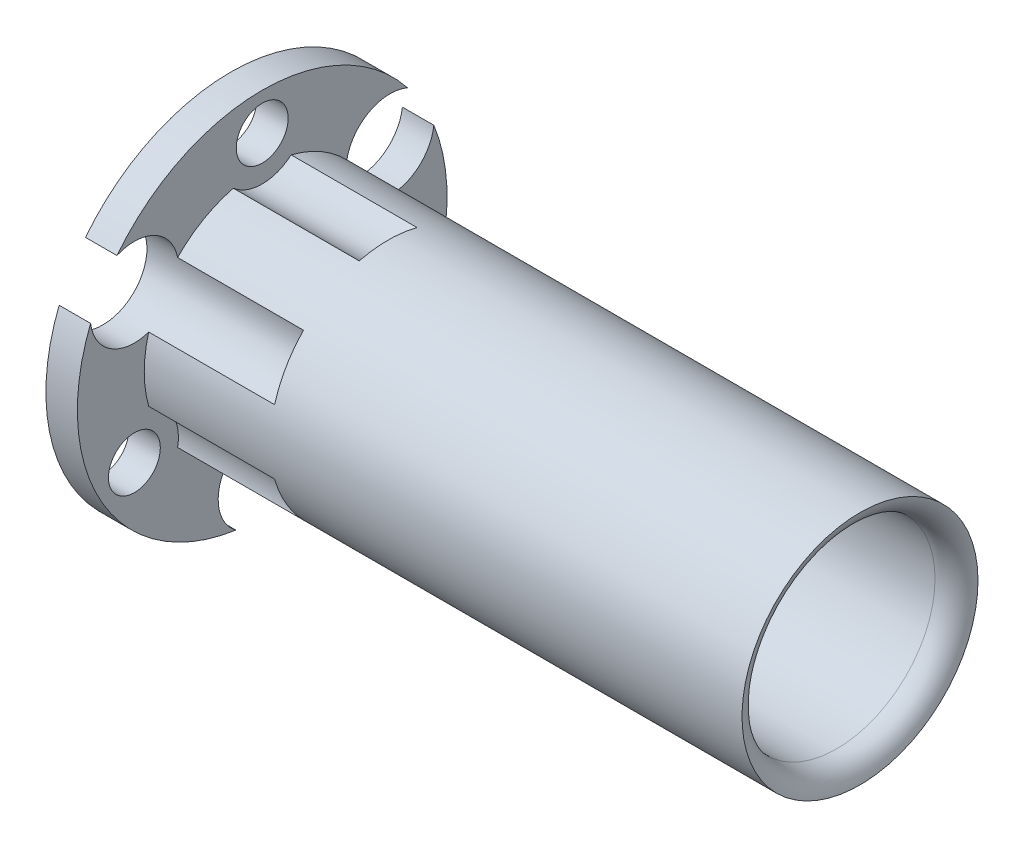
from build123d import *
from build123d.topology import SkipClean

# Parameters (mm, degrees)
SKETCH1_R                 = 1.6500000000000006
SKETCH1_R_2               = 6.25
SKETCH1_R_3               = 1.6500000000000004
BOSS_EXTRUDE1_DEPTH       = 2
BOSS_EXTRUDE2_START       = 2
BOSS_EXTRUDE2_OUTLINE_R   = 7.5
BOSS_EXTRUDE2_OUTLINE_R_2 = 6.25
BOSS_EXTRUDE2_DEPTH       = 38
CUT_EXTRUDE2_START        = 2
SKETCH1_4_R               = 2.8
SKETCH1_4_R_2             = 2.8000000000000003
SKETCH1_4_R_3             = 2.7999999999999994
SKETCH1_4_R_4             = 2.8000000000000016
CUT_EXTRUDE2_DEPTH        = 8
CUT_EXTRUDE3_START        = 2
SKETCH1_5_R               = 2.8
SKETCH1_5_R_2             = 2.7999999999999994
SKETCH1_5_R_3             = 2.8000000000000016
CUT_EXTRUDE3_DEPTH        = 46.314258622305886
FILLET1_R                 = 1.5


# Read off the part's stored shape, not the designer's step: Boss-Extrude2
with BuildPart() as part:
    # Sketch1 → Boss-Extrude1 (new body)
    with BuildSketch(Plane(origin=(0, 0, 0), x_dir=(0, 0, -1), z_dir=(1, 0, 0))):
        with BuildLine():
            ThreePointArc((-9.235679756024062, 7.263932780812693), (-6.819714318196267, 7.1682440093196265), (-5.379034853060263, 5.226469558848167))
            ThreePointArc((-5.37903485305997, 5.226469558848125), (-6.495190528383201, 3.7500000000001563), (-7.215772836598412, 2.0451460511681123))
            ThreePointArc((-7.215772836598439, 2.0451460511681465), (-9.617738571694561, 2.3219238414507375), (-10.908590197578363, 4.366366899528586))
            ThreePointArc((-10.908590197578294, 4.366366899528582), (-10.175798494467182, -5.8749999999999565), (-1.672910441554004, -11.630299680340986))
            ThreePointArc((-1.6729104415540204, -11.630299680341029), (-2.7980242534982347, -9.490167850770279), (-1.836737983538199, -7.271615610016004))
            ThreePointArc((-1.8367379835382087, -7.271615610015976), (-1.38e-15, -7.500000000000001), (1.8367379835382058, -7.271615610015976))
            ThreePointArc((1.8367379835381987, -7.271615610016002), (2.798024253498237, -9.49016785077028), (1.6729104415540168, -11.630299680341032))
            ThreePointArc((1.672910441553996, -11.630299680340986), (10.175798494467136, -5.8750000000000355), (10.908590197578357, 4.366366899528418))
            ThreePointArc((10.908590197578427, 4.3663668995284235), (9.617738571694534, 2.3219238414505634), (7.215772836598344, 2.0451460511680883))
            ThreePointArc((7.2157728365984, 2.0451460511681567), (6.495190528383213, 3.7500000000001346), (5.379034853060037, 5.226469558848057))
            ThreePointArc((5.379034853060338, 5.226469558848102), (6.81971431819637, 7.168244009319535), (9.235679756024162, 7.263932780812571))
            ThreePointArc((9.235679756024219, 7.263932780812644), (7.994e-14, 11.750000000000004), (-9.235679756024119, 7.26393278081277))
        make_face()
        with Locations((-8.127648414516955, -4.692500000000004)):
            Circle(SKETCH1_R, mode=Mode.SUBTRACT)
        Circle(SKETCH1_R_2, mode=Mode.SUBTRACT)
        with Locations((8.127648414516958, -4.692499999999999)):
            Circle(SKETCH1_R, mode=Mode.SUBTRACT)
        with Locations((-1.7e-16, 9.385)):
            Circle(SKETCH1_R_3, mode=Mode.SUBTRACT)
    extrude(amount=BOSS_EXTRUDE1_DEPTH)

    # Boss-Extrude2 outline → Boss-Extrude2 (add)
    with BuildSketch(Plane(origin=(0, 0, 0), x_dir=(0, 0, -1), z_dir=(1, 0, 0)).offset(BOSS_EXTRUDE2_START)):
        Circle(BOSS_EXTRUDE2_OUTLINE_R)
        Circle(BOSS_EXTRUDE2_OUTLINE_R_2, mode=Mode.SUBTRACT)
    extrude(amount=BOSS_EXTRUDE2_DEPTH)

    # Sketch1<4> → Cut-Extrude2 (cut)
    with BuildSketch(Plane(origin=(0, 0, 0), x_dir=(0, 0, -1), z_dir=(1, 0, 0)).offset(CUT_EXTRUDE2_START)):
        with Locations((1.15e-15, -9.385)):
            Circle(SKETCH1_4_R)
        with Locations((-8.127648414517033, -4.692499999999865)):
            Circle(SKETCH1_4_R_2)
        with Locations((-8.127648414516935, 4.692500000000037)):
            Circle(SKETCH1_4_R_3)
        with Locations((6.439e-14, 9.385)):
            Circle(SKETCH1_4_R)
        with Locations((8.127648414517003, 4.692499999999925)):
            Circle(SKETCH1_4_R_4)
        with Locations((8.127648414516901, -4.692500000000093)):
            Circle(SKETCH1_4_R_3)
    extrude(amount=CUT_EXTRUDE2_DEPTH, mode=Mode.SUBTRACT)

    # Sketch1<5> → Cut-Extrude3 (cut, through all)
    with SkipClean():  # the faces are left unmerged after this step: merging them gives an invalid solid
        with BuildSketch(Plane(origin=(0, 0, 0), x_dir=(0, 0, -1), z_dir=(1, 0, 0)).offset(CUT_EXTRUDE3_START)):
            with Locations((1.15e-15, -9.385)):
                Circle(SKETCH1_5_R)
            with Locations((-8.127648414516935, 4.692500000000037)):
                Circle(SKETCH1_5_R_2)
            with Locations((8.127648414517003, 4.692499999999925)):
                Circle(SKETCH1_5_R_3)
        extrude(amount=-CUT_EXTRUDE3_DEPTH, mode=Mode.SUBTRACT)

    # Fillet1
    # the kernel refuses this fillet: 1.5 mm, written as the material it takes off along each edge
    with BuildSketch(Plane(origin=(40, 0, 0), x_dir=(0, 0, -1), z_dir=(0, -1, 0))) as fillet1_piece_1:
        with BuildLine():
            CenterArc((7.75, -1.4790199457750504), FILLET1_R, 99.59406822685953, 80.40593177314048)
            Line((7.500000000000024, -1.4211e-13), (7.495000000000024, 0.02958039891535691))
            ThreePointArc((7.495000000000024, 0.02958039891535691), (6.875000000000012, 0.03000000000000114), (6.25, 0.03000000000000114))
            Line((6.25, 0.03000000000000114), (6.22, 0))
            Line((6.22, 0), (6.22, -1.4790199457750504))
            Line((6.22, -1.4790199457750504), (6.25, -1.4790199457750504))
        make_face()
    revolve(axis=Axis((40, 0, 0), (1, 0, 0)), mode=Mode.SUBTRACT)


solid = part.part
